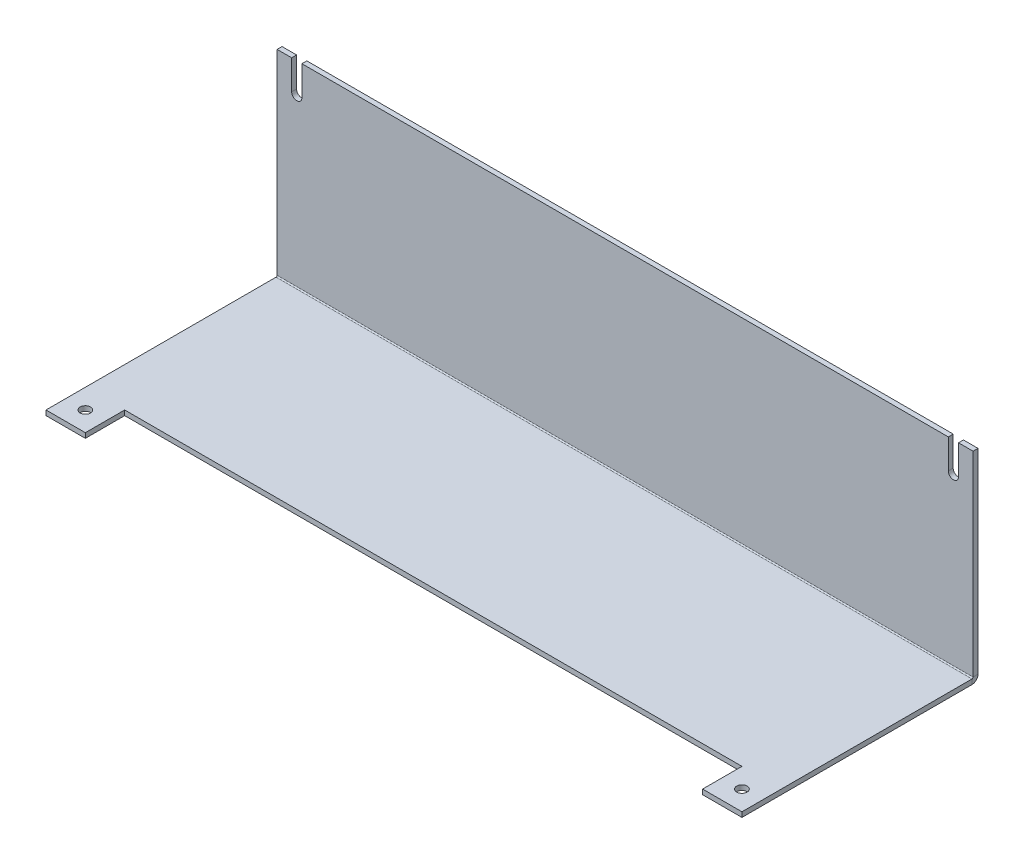
from build123d import *

# Parameters (mm, degrees)
SKETCH1_W                    = 449.326
SKETCH1_H                    = 127
BASE_FLANGE1_DEPTH           = 3.175
EDGE_FLANGE1_STRIP_W         = 14.1732
EDGE_FLANGE1_STRIP_H         = 3.175
EDGE_FLANGE1_STRIP_CUT_DEPTH = 449.326
EDGE_FLANGE1_DEPTH           = 449.326
CUT_EXTRUDE1_DEPTH           = 484.892399482
SKETCH10_W                   = 25.4
SKETCH10_H                   = 3.175
BOSS_EXTRUDE1_DEPTH          = 25.4
F_1_4_CLEARANCE_HOLE1_D      = 6.7564
F_1_4_CLEARANCE_HOLE1_DEPTH  = 25.4
F_1_4_CLEARANCE_HOLE1_TIP    = 2.029827343


# Sheet-metal steps are written as plain solids
with BuildPart() as part:
    # Sketch1 → Base-Flange1 (new body)
    with BuildSketch(Plane(origin=(0, 0, 0), x_dir=(1, 0, 0), z_dir=(0, 1, 0))):
        with Locations((224.663, 63.5)):
            Rectangle(SKETCH1_W, SKETCH1_H)
    extrude(amount=-BASE_FLANGE1_DEPTH)

    # Edge-Flange1 strip (across the edge) → Edge-Flange1 strip cut (cut)
    with BuildSketch(Plane(origin=(449.326, 0, -127), x_dir=(0, 0, 1), z_dir=(-1, 0, 0))):
        with Locations((-3.175, -1.5875)):
            Rectangle(EDGE_FLANGE1_STRIP_W, EDGE_FLANGE1_STRIP_H)
    extrude(amount=EDGE_FLANGE1_STRIP_CUT_DEPTH, mode=Mode.SUBTRACT)

    # Edge-Flange1 section (across the edge) → Edge-Flange1 (add)
    with BuildSketch(Plane(origin=(449.326, 0, -127), x_dir=(0, 0, 1), z_dir=(-1, 0, 0))):
        with BuildLine():
            Line((0, 0.7366), (0, 127))
            Line((0, 127), (3.175, 127))
            Line((3.175, 127), (3.175, 0.7366))
            ThreePointArc((3.175, 0.7366), (3.390745145, 0.215745145), (3.9116, 0))
            Line((3.9116, 0), (3.9116, -3.175))
            ThreePointArc((3.9116, -3.175), (1.145681115, -2.029318885), (0, 0.7366))
        make_face()
    extrude(amount=EDGE_FLANGE1_DEPTH)

    # Sketch9 → Cut-Extrude1 (cut, through all)
    with BuildSketch(Plane(origin=(0, 0, -127), x_dir=(-1, 0, 0), z_dir=(0, 0, -1))):
        with BuildLine():
            Line((-433.324, 107.95), (-433.324, 127))
            Line((-433.324, 127), (-439.928, 127))
            Line((-439.928, 127), (-439.928, 107.95))
            ThreePointArc((-439.928, 107.95), (-436.626, 104.648), (-433.324, 107.95))
        make_face()
        with BuildLine():
            Line((-16.002, 107.95), (-16.002, 127))
            Line((-16.002, 127), (-9.398, 127))
            Line((-9.398, 127), (-9.398, 107.95))
            ThreePointArc((-9.398, 107.95), (-12.7, 104.648), (-16.002, 107.95))
        make_face()
    extrude(amount=-CUT_EXTRUDE1_DEPTH, mode=Mode.SUBTRACT)

    # Sketch10 → Boss-Extrude1 (add)
    with BuildSketch(Plane.XY):
        with Locations((436.626, -1.5875)):
            Rectangle(SKETCH10_W, SKETCH10_H)
        with Locations((12.7, -1.5875)):
            Rectangle(SKETCH10_W, SKETCH10_H)
    extrude(amount=BOSS_EXTRUDE1_DEPTH)

    # 1/4 Clearance Hole1
    with Locations(Plane(origin=(12.7, -3.175, 12.7), x_dir=(0, 0, -1), z_dir=(0, -1, 0))):
        with Locations((0, 0), (0, 423.926)):
            Hole(F_1_4_CLEARANCE_HOLE1_D / 2, depth=F_1_4_CLEARANCE_HOLE1_DEPTH)
            with Locations((0, 0, -(F_1_4_CLEARANCE_HOLE1_DEPTH + F_1_4_CLEARANCE_HOLE1_TIP / 2))):  # 118° drill point
                Cone(0, F_1_4_CLEARANCE_HOLE1_D / 2, F_1_4_CLEARANCE_HOLE1_TIP, mode=Mode.SUBTRACT)


solid = part.part
